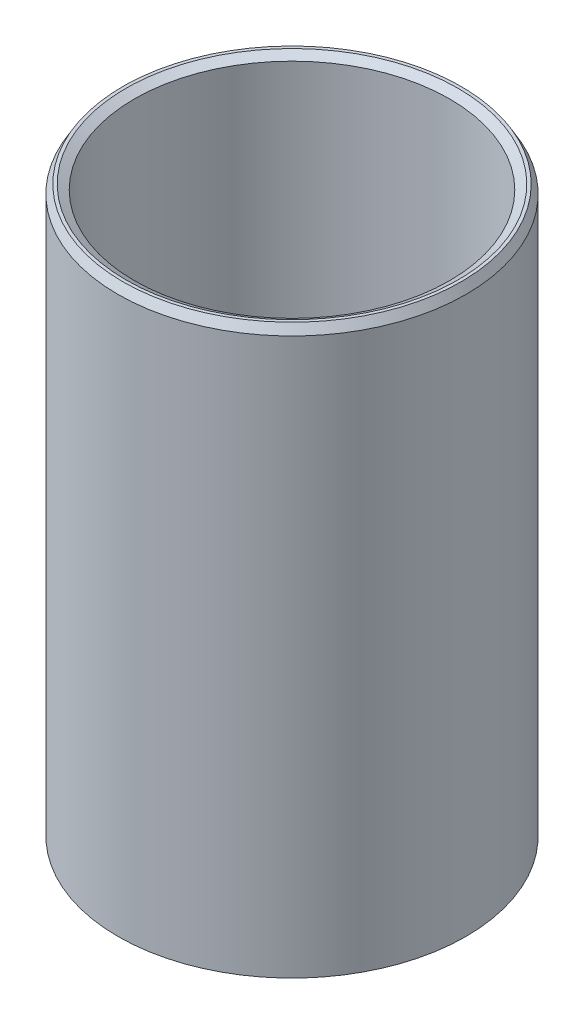
from build123d import *
from OCP.BRepFilletAPI import BRepFilletAPI_MakeChamfer

# Parameters (mm, degrees)
SKETCH1_R           = 52.5
BOSS_EXTRUDE1_DEPTH = 171.761595614
SKETCH2_R           = 47.518682218
CUT_EXTRUDE1_DEPTH  = 188.121740394
CHAMFER1_SIZE       = 2.56307634
CHAMFER1_SIZE2      = 1.479792815


with BuildPart() as part:
    # Sketch1 → Boss-Extrude1 (new body)
    with BuildSketch(Plane(origin=(0, 0, 0), x_dir=(1, 0, 0), z_dir=(0, 1, 0))):
        Circle(SKETCH1_R)
    extrude(amount=BOSS_EXTRUDE1_DEPTH)

    # Sketch2 → Cut-Extrude1 (cut, through all)
    with BuildSketch(Plane(origin=(0, 0, 0), x_dir=(1, 0, 0), z_dir=(0, 1, 0))):
        Circle(SKETCH2_R)
    extrude(amount=CUT_EXTRUDE1_DEPTH, mode=Mode.SUBTRACT)

    # Chamfer1: one chamfer whose edges measure the first distance from different faces: ONE call of the kernel's chamfer builder (chamfer() names one face for all edges)
    chamfer1_edges_1 = [part.edges().sort_by_distance(p)[0] for p in [
        (-47.518682218, 171.761595614, 0),
    ]]
    chamfer1_side_1 = [part.faces().sort_by_distance(p)[0] for p in [
        (-51.01507576, 171.761595614, 0),
    ]]
    chamfer1_edges_2 = [part.edges().sort_by_distance(p)[0] for p in [
        (-47.518682218, 0, 0),
    ]]
    chamfer1_side_2 = [part.faces().sort_by_distance(p)[0] for p in [
        (-47.518682218, 85.880797807, 0),
    ]]
    chamfer1_edges_3 = [part.edges().sort_by_distance(p)[0] for p in [
        (-52.5, 0, 0),
    ]]
    chamfer1_side_3 = [part.faces().sort_by_distance(p)[0] for p in [
        (-51.01507576, 0, 0),
    ]]
    chamfer1_edges_4 = [part.edges().sort_by_distance(p)[0] for p in [
        (-52.5, 171.761595614, 0),
    ]]
    chamfer1_side_4 = [part.faces().sort_by_distance(p)[0] for p in [
        (-52.5, 85.880797807, 0),
    ]]
    chamfer1 = BRepFilletAPI_MakeChamfer(part.part.solid().wrapped)
    for e in chamfer1_edges_1:
        chamfer1.Add(CHAMFER1_SIZE, CHAMFER1_SIZE2, e.wrapped, chamfer1_side_1[0].wrapped)  # the first distance lies on this face
    for e in chamfer1_edges_2:
        chamfer1.Add(CHAMFER1_SIZE, CHAMFER1_SIZE2, e.wrapped, chamfer1_side_2[0].wrapped)  # the first distance lies on this face
    for e in chamfer1_edges_3:
        chamfer1.Add(CHAMFER1_SIZE, CHAMFER1_SIZE2, e.wrapped, chamfer1_side_3[0].wrapped)  # the first distance lies on this face
    for e in chamfer1_edges_4:
        chamfer1.Add(CHAMFER1_SIZE, CHAMFER1_SIZE2, e.wrapped, chamfer1_side_4[0].wrapped)  # the first distance lies on this face
    add(Compound.cast(chamfer1.Shape()), mode=Mode.REPLACE)


solid = part.part
